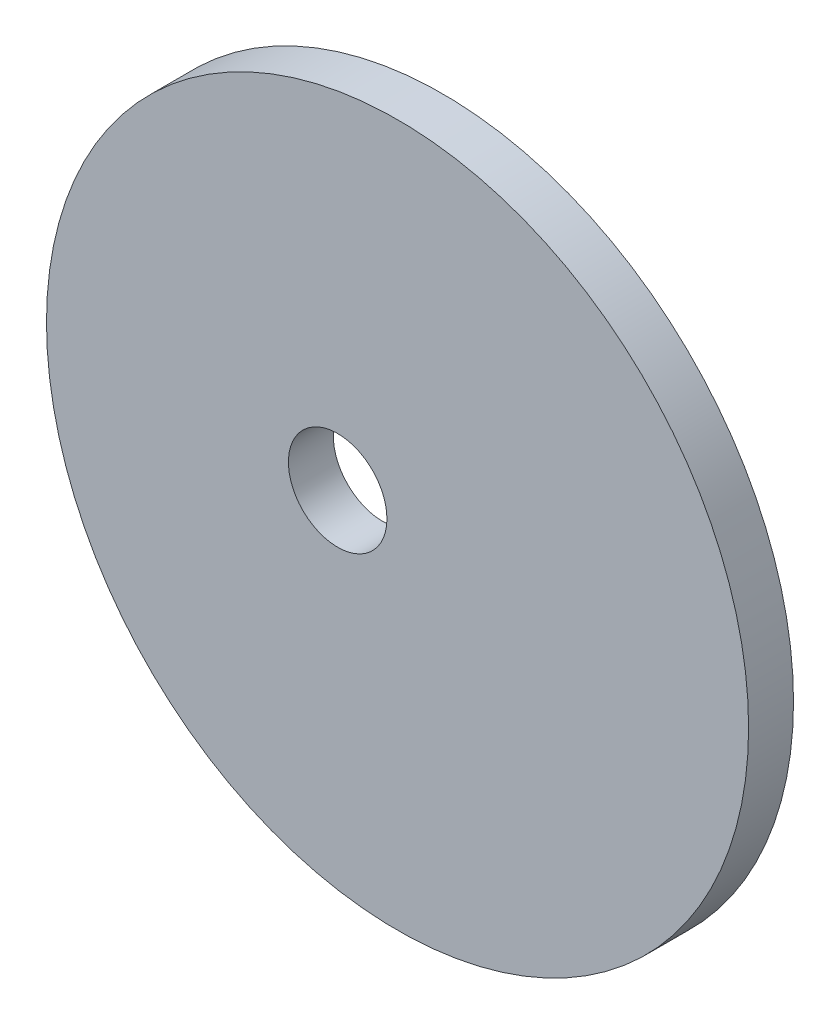
from build123d import *

# Parameters (mm, degrees)
SKETCH1_R           = 23.453125
SKETCH1_R_2         = 3.290625
BOSS_EXTRUDE5_DEPTH = 3
SKETCH6_R           = 23.453125
SKETCH6_R_2         = 3.290625
BOSS_EXTRUDE9_DEPTH = 2


with BuildPart() as part:
    # Sketch1 → Boss-Extrude5 (new body)
    with BuildSketch(Plane.XY):
        Circle(SKETCH1_R)
        with Locations((-4, 0)):
            Circle(SKETCH1_R_2, mode=Mode.SUBTRACT)
    extrude(amount=BOSS_EXTRUDE5_DEPTH)

    # Sketch6 → Boss-Extrude9 (add)
    with BuildSketch(Plane.XY):
        Circle(SKETCH6_R)
        with Locations((-4, 0)):
            Circle(SKETCH6_R_2, mode=Mode.SUBTRACT)
    extrude(amount=BOSS_EXTRUDE9_DEPTH)


solid = part.part
